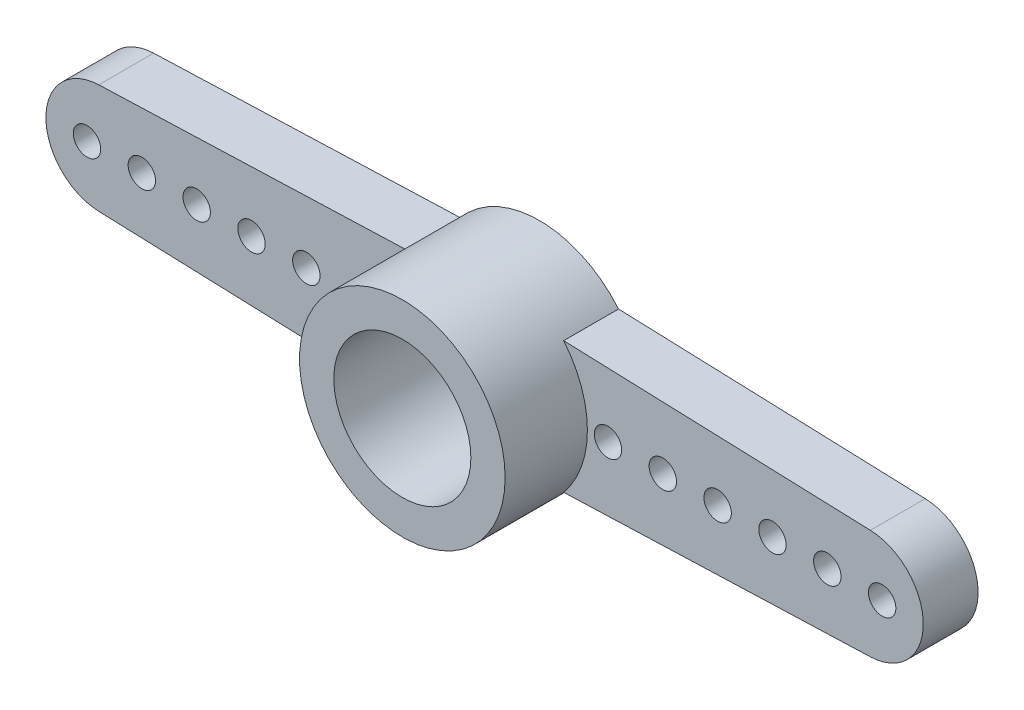
from build123d import *

# Parameters (mm, degrees)
EXTRUDE_3_DEPTH     = 2
EXTRUDE_3_2_DEPTH   = 2
SKETCH_2_R          = 3.7500000000000004
SKETCH_2_R_2        = 2.5
EXTRUDE_5_DEPTH     = 3
EXTRUDE_START       = 2
SKETCH_3_R          = 3.75
SKETCH_3_R_2        = 2.5
EXTRUDE_6_DEPTH     = 2
SKETCH_4_R          = 0.5
SKETCH_4_R_2        = 0.500000000000001
SKETCH_4_R_3        = 0.5000000000000003
SKETCH_4_R_4        = 0.5000000000000008
CUT_EXTRUDE_1_DEPTH = 2
SKETCH_5_R          = 2.5
EXTRUDE_7_DEPTH     = 1
SKETCH_6_R          = 2.5
CUT_EXTRUDE_2_DEPTH = 0.5
SKETCH_7_R          = 1.25
CUT_EXTRUDE_3_DEPTH = 5


with BuildPart() as part:
    # Эскиз1 → Бобышка-Вытянуть3 (new body)
    with BuildSketch(Plane.XY):
        with BuildLine():
            ThreePointArc((-2.885470710277234, -2.3951114337609), (-3.5272521290332812, -1.2731820051470197), (-3.75, 4.6e-16))
            ThreePointArc((-3.75, 4.6e-16), (-3.527252129033281, 1.2731820051470206), (-2.8854707102772337, 2.395111433760901))
            Line((-2.8854707102772306, 2.395111433760893), (-14.070827840369605, 1.9987454607899853))
            ThreePointArc((-14.070827840369605, 1.9987454607899855), (-15.999999999999998, -1.46e-15), (-14.070827840369605, -1.9987454607899888))
            Line((-14.070827840369605, -1.9987454607899888), (-2.8854707102772306, -2.395111433760894))
        make_face()
    extrude(amount=EXTRUDE_3_DEPTH)



with BuildPart() as body_2:
    # Эскиз1 → Extrude 3 2 (new body)
    with BuildSketch(Plane.XY):
        with BuildLine():
            Line((14.070827840369605, 1.9987454607899893), (2.885470710277234, 2.395111433760894))
            ThreePointArc((2.8854707102772355, 2.3951114337608983), (3.7500000000000004, 3.952e-14), (2.8854707102772856, -2.3951114337608375))
            Line((2.885470710277307, -2.3951114337608894), (14.070827840369605, -1.9987454607899817))
            ThreePointArc((14.070827840369605, -1.9987454607899808), (15.999999999999996, 4.91e-15), (14.070827840369605, 1.9987454607899904))
        make_face()
    extrude(amount=EXTRUDE_3_2_DEPTH)


with BuildPart() as body_3:
    # Эскиз2 → Бобышка-Вытянуть5 (new body)
    with BuildSketch(Plane.XY.offset(2)):
        Circle(SKETCH_2_R)
        Circle(SKETCH_2_R_2, mode=Mode.SUBTRACT)
    extrude(amount=EXTRUDE_5_DEPTH)


with BuildPart() as part_1:
    add(part.part)

    add(body_2.part)  # Бобышка-Вытянуть6 merges body 2

    add(body_3.part)  # Бобышка-Вытянуть6 merges body 3
    # Эскиз3 → Бобышка-Вытянуть6 (add)
    with BuildSketch(Plane(origin=(0, 0, 2), x_dir=(-1, 0, 0), z_dir=(0, 0, -1)).offset(EXTRUDE_START)):
        Circle(SKETCH_3_R)
        Circle(SKETCH_3_R_2, mode=Mode.SUBTRACT)
    extrude(amount=-EXTRUDE_6_DEPTH)

    # Эскиз4 → Вырез-Вытянуть1 (cut)
    with BuildSketch(Plane(origin=(0, 0, 0), x_dir=(-1, 0, 0), z_dir=(0, 0, -1))):
        with Locations((-14.5, -7.9e-16)):
            Circle(SKETCH_4_R)
        with Locations((-4.500000000000001, 5.8e-16)):
            Circle(SKETCH_4_R_2)
        with Locations((-6.500000000000001, 5.8e-16)):
            Circle(SKETCH_4_R_2)
        with Locations((-8.5, -5.3e-16)):
            Circle(SKETCH_4_R_3)
        with Locations((-10.5, -7.9e-16)):
            Circle(SKETCH_4_R)
        with Locations((-12.5, -7.9e-16)):
            Circle(SKETCH_4_R)
        with Locations((4.500000000000001, 0)):
            Circle(SKETCH_4_R_4)
        with Locations((6.500000000000001, 0)):
            Circle(SKETCH_4_R_4)
        with Locations((8.5, 0)):
            Circle(SKETCH_4_R_4)
        with Locations((10.5, 0)):
            Circle(SKETCH_4_R_4)
        with Locations((12.5, 0)):
            Circle(SKETCH_4_R_4)
        with Locations((14.5, 0)):
            Circle(SKETCH_4_R_4)
    extrude(amount=-CUT_EXTRUDE_1_DEPTH, mode=Mode.SUBTRACT)

    # Эскиз5 → Бобышка-Вытянуть7 (add)
    with BuildSketch(Plane(origin=(0, 0, 0), x_dir=(-1, 0, 0), z_dir=(0, 0, -1))):
        Circle(SKETCH_5_R)
    extrude(amount=-EXTRUDE_7_DEPTH)

    # Эскиз6 → Вырез-Вытянуть2 (cut)
    with BuildSketch(Plane(origin=(0, 0, 0), x_dir=(-1, 0, 0), z_dir=(0, 0, -1))):
        Circle(SKETCH_6_R)
    extrude(amount=-CUT_EXTRUDE_2_DEPTH, mode=Mode.SUBTRACT)

    # Эскиз7 → Вырез-Вытянуть3 (cut)
    with BuildSketch(Plane(origin=(0, 0, 0.5), x_dir=(-1, 0, 0), z_dir=(0, 0, -1))):
        Circle(SKETCH_7_R)
    extrude(amount=-CUT_EXTRUDE_3_DEPTH, mode=Mode.SUBTRACT)


solid = part_1.part
